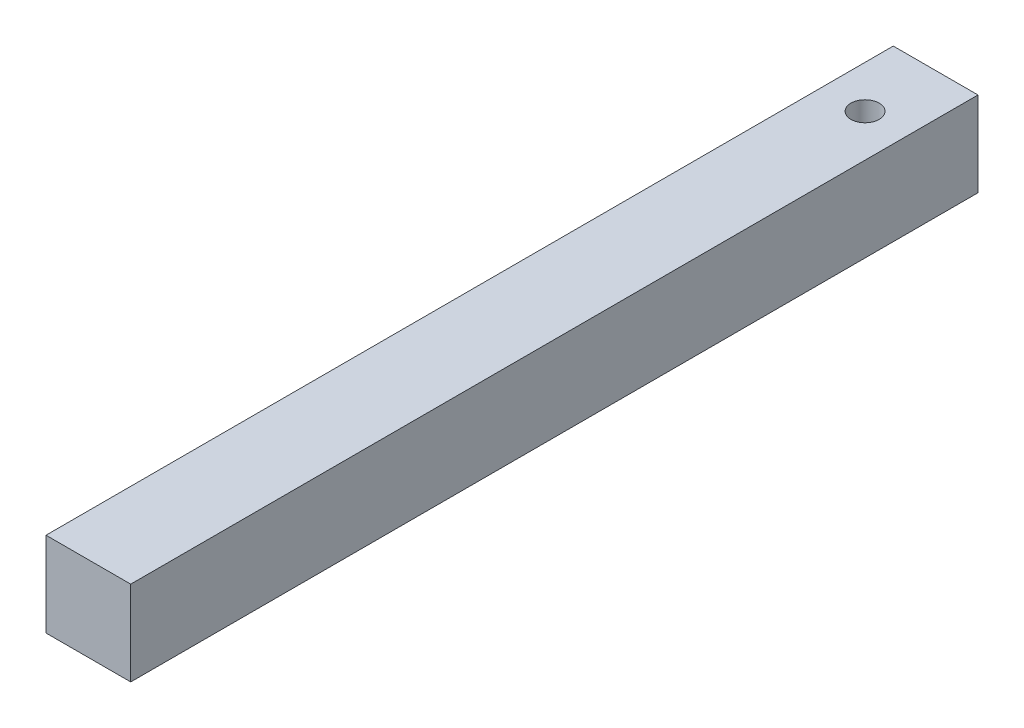
from build123d import *

# Parameters (mm, degrees)
SKETCH1_W          = 19.05
SKETCH1_H          = 190.5
PROFILE_DEPTH      = 19.05
SKETCH10_R         = 3.175
CUT_EXTRUDE1_DEPTH = 41.148


with BuildPart() as part:
    # Sketch1 → Profile (new body)
    with BuildSketch(Plane(origin=(0, 0, 0), x_dir=(1, 0, 0), z_dir=(0, 1, 0))):
        Rectangle(SKETCH1_W, SKETCH1_H)
    extrude(amount=PROFILE_DEPTH)

    # Sketch10 → Cut-Extrude1 (cut)
    with BuildSketch(Plane(origin=(0, 19.05, 0), x_dir=(1, 0, 0), z_dir=(0, 1, 0))):
        with Locations((0, 79.375)):
            Circle(SKETCH10_R)
    extrude(amount=-CUT_EXTRUDE1_DEPTH, mode=Mode.SUBTRACT)


solid = part.part
